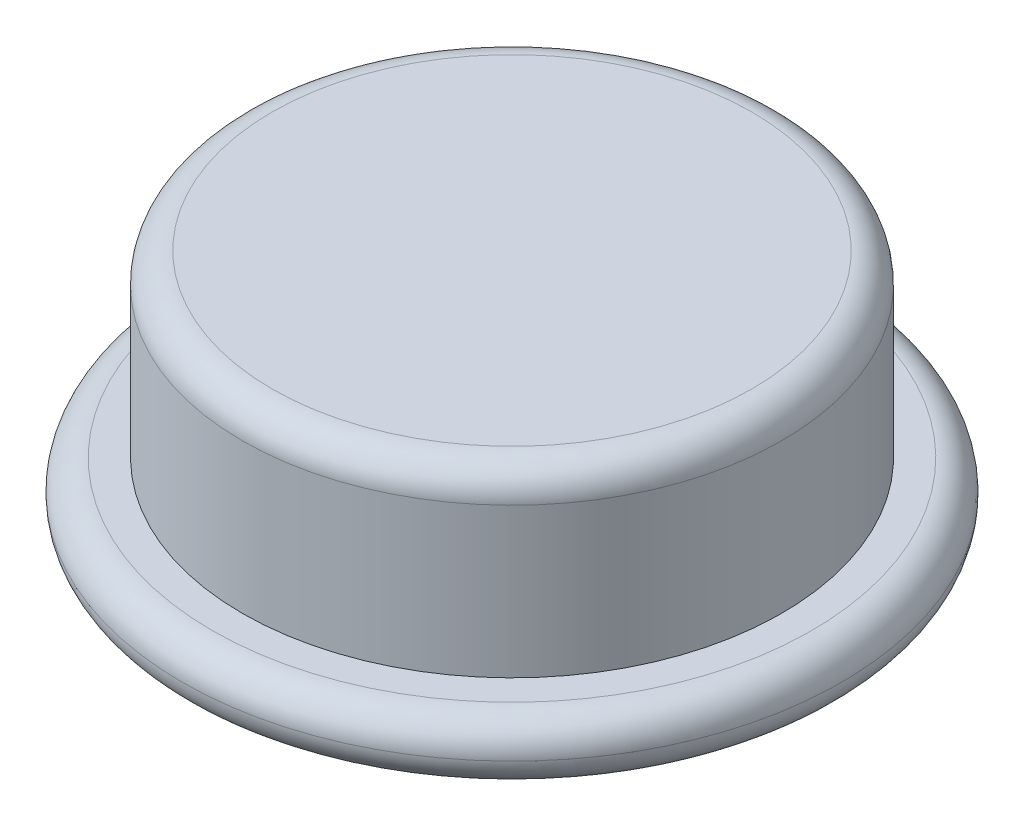
from build123d import *

# Parameters (mm, degrees)
FILLET1_R = 0.5


with BuildPart() as part:
    # Sketch1 → Revolve1 (revolve)
    with BuildSketch(Plane(origin=(0, 0, 0), x_dir=(0, 0, -1), z_dir=(1, 0, 0))):
        Polygon((0, 0), (0, 4), (-4.5125, 4), (-4.5125, 1), (-5.5125, 1), (-5.5125, 0), align=None)
    revolve(axis=Axis((0, 0, 0), (0, -1, 0)))

    # Fillet1
    fillet1_edges = [part.edges().sort_by_distance(p)[0] for p in [
        (0, 0, -5.5125),
        (0, 1, -5.5125),
        (0, 4, -4.5125),
    ]]
    fillet(fillet1_edges, radius=FILLET1_R - 0.0001)  # a hair under: the kernel refuses the full size


solid = part.part
